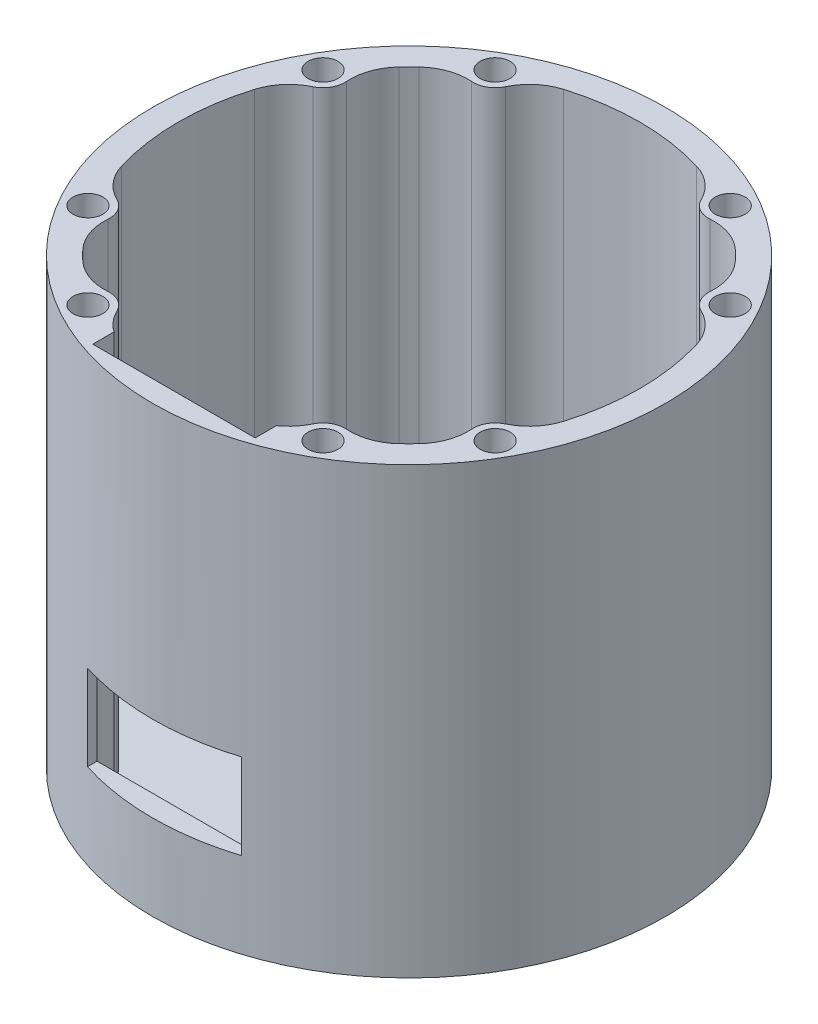
from build123d import *

# Parameters (mm, degrees)
SKETCH1_R           = 30
BOSS_EXTRUDE1_DEPTH = 52
CUT_EXTRUDE1_DEPTH  = 47
FILLET1_R           = 6
SKETCH4_W           = 19
SKETCH4_H           = 3
CUT_EXTRUDE3_DEPTH  = 45
SKETCH6_R           = 1.75
CUT_EXTRUDE4_DEPTH  = 5.5
CUT_EXTRUDE5_REACH  = 69.112
SKETCH7_W           = 18
SKETCH7_H           = 10


with BuildPart() as part:
    # Sketch1 → Boss-Extrude1 (new body)
    with BuildSketch(Plane(origin=(0, 0, 0), x_dir=(1, 0, 0), z_dir=(0, 1, 0))):
        Circle(SKETCH1_R)
    extrude(amount=BOSS_EXTRUDE1_DEPTH)

    # Sketch2 → Cut-Extrude1 (cut)
    with BuildSketch(Plane(origin=(0, 52, 0), x_dir=(1, 0, 0), z_dir=(0, 1, 0))):
        with BuildLine():
            ThreePointArc((-15.586619137, 22.046707325), (-19.091883092, 19.091883092), (-22.046707325, 15.586619137))
            ThreePointArc((-22.046707325, 15.586619137), (-21.607333824, 12.475), (-24.521761794, 11.299699045))
            ThreePointArc((-24.521761794, 11.299699045), (-27, 0), (-24.521761794, -11.299699045))
            ThreePointArc((-24.521761794, -11.299699045), (-21.607333824, -12.475), (-22.046707325, -15.586619137))
            ThreePointArc((-22.046707325, -15.586619137), (-19.091883092, -19.091883092), (-15.586619137, -22.046707325))
            ThreePointArc((-15.586619137, -22.046707325), (-12.475, -21.607333824), (-11.299699045, -24.521761794))
            ThreePointArc((-11.299699045, -24.521761794), (0, -27), (11.299699045, -24.521761794))
            ThreePointArc((11.299699045, -24.521761794), (12.475, -21.607333824), (15.586619137, -22.046707325))
            ThreePointArc((15.586619137, -22.046707325), (19.091883092, -19.091883092), (22.046707325, -15.586619137))
            ThreePointArc((22.046707325, -15.586619137), (21.607333824, -12.475), (24.521761794, -11.299699045))
            ThreePointArc((24.521761794, -11.299699045), (27, 0), (24.521761794, 11.299699045))
            ThreePointArc((24.521761794, 11.299699045), (21.607333824, 12.475), (22.046707325, 15.586619137))
            ThreePointArc((22.046707325, 15.586619137), (19.091883092, 19.091883092), (15.586619137, 22.046707325))
            ThreePointArc((15.586619137, 22.046707325), (12.475, 21.607333824), (11.299699045, 24.521761794))
            ThreePointArc((11.299699045, 24.521761794), (0, 27), (-11.299699045, 24.521761794))
            ThreePointArc((-11.299699045, 24.521761794), (-12.475, 21.607333824), (-15.586619137, 22.046707325))
        make_face()
    extrude(amount=-CUT_EXTRUDE1_DEPTH, mode=Mode.SUBTRACT)

    # Fillet1
    fillet1_edges = [part.edges().sort_by_distance(p)[0] for p in [
        (-22.046707325, 28.5, -15.586619137),
        (-24.521761794, 28.5, -11.299699045),
        (-24.521761794, 28.5, 11.299699045),
        (-22.046707325, 28.5, 15.586619137),
        (-15.586619137, 28.5, 22.046707325),
        (-11.299699045, 28.5, 24.521761794),
        (11.299699045, 28.5, 24.521761794),
        (15.586619137, 28.5, 22.046707325),
        (22.046707325, 28.5, 15.586619137),
        (24.521761794, 28.5, 11.299699045),
        (24.521761794, 28.5, -11.299699045),
        (22.046707325, 28.5, -15.586619137),
        (15.586619137, 28.5, -22.046707325),
        (11.299699045, 28.5, -24.521761794),
        (-11.299699045, 28.5, -24.521761794),
        (-15.586619137, 28.5, -22.046707325),
    ]]
    fillet(fillet1_edges, radius=FILLET1_R)

    # Sketch4 → Cut-Extrude3 (cut)
    with BuildSketch(Plane(origin=(0, 52, 0), x_dir=(1, 0, 0), z_dir=(0, 1, 0))):
        with Locations((0, -26)):
            Rectangle(SKETCH4_W, SKETCH4_H)
    extrude(amount=-CUT_EXTRUDE3_DEPTH, mode=Mode.SUBTRACT)

    # Sketch6 → Cut-Extrude4 (cut)
    with BuildSketch(Plane(origin=(0, 52, 0), x_dir=(1, 0, 0), z_dir=(0, 1, 0))):
        with Locations((-13.75, 23.815698604)):
            Circle(SKETCH6_R)
        with Locations((-23.815698604, 13.75)):
            Circle(SKETCH6_R)
        with Locations((-23.815698604, -13.75)):
            Circle(SKETCH6_R)
        with Locations((-13.75, -23.815698604)):
            Circle(SKETCH6_R)
        with Locations((13.75, -23.815698604)):
            Circle(SKETCH6_R)
        with Locations((23.815698604, -13.75)):
            Circle(SKETCH6_R)
        with Locations((23.815698604, 13.75)):
            Circle(SKETCH6_R)
        with Locations((13.75, 23.815698604)):
            Circle(SKETCH6_R)
    extrude(amount=-CUT_EXTRUDE4_DEPTH, mode=Mode.SUBTRACT)

    # Sketch7 → Cut-Extrude5 (cut, up to next)
    with BuildSketch(Plane.XY, mode=Mode.PRIVATE) as cut_extrude5_sk1:
        with Locations((0, 15)):
            Rectangle(SKETCH7_W, SKETCH7_H)
    cut_extrude5_tool1 = extrude(cut_extrude5_sk1.sketch, amount=CUT_EXTRUDE5_REACH, mode=Mode.PRIVATE) & part.part
    add(cut_extrude5_tool1.solids().sort_by_distance((0, 15, 0))[0], mode=Mode.SUBTRACT)


solid = part.part
